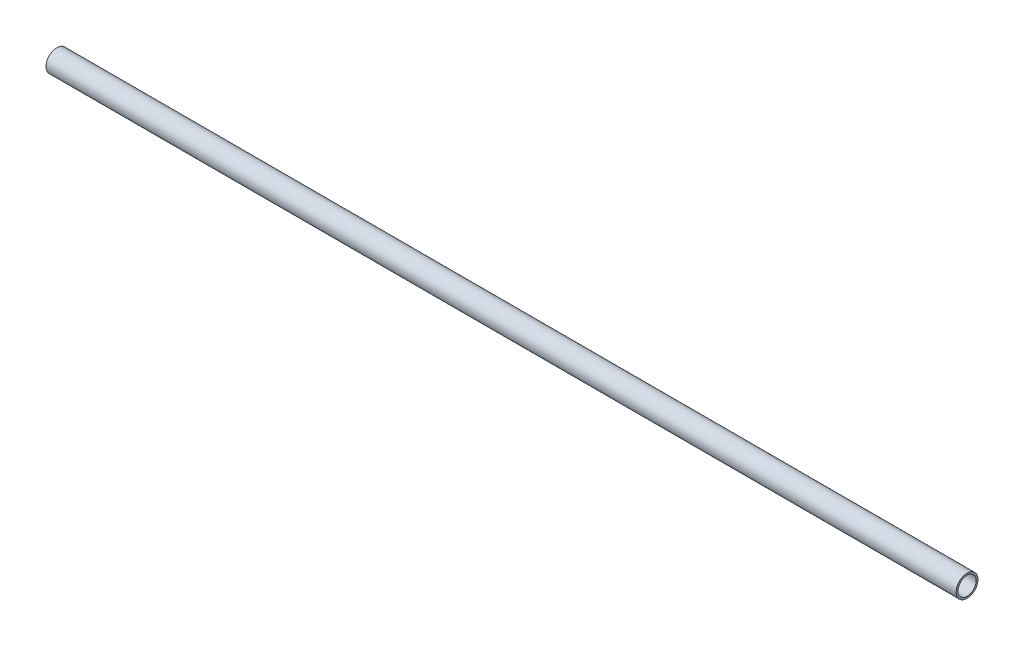
from build123d import *

# Parameters (mm, degrees)
SKETCH1_R           = 6
SKETCH1_R_2         = 5
BOSS_EXTRUDE1_DEPTH = 500


with BuildPart() as part:
    # Sketch1 → Boss-Extrude1 (new body)
    with BuildSketch(Plane.YZ):
        Circle(SKETCH1_R)
        Circle(SKETCH1_R_2, mode=Mode.SUBTRACT)
    extrude(amount=BOSS_EXTRUDE1_DEPTH)


solid = part.part
